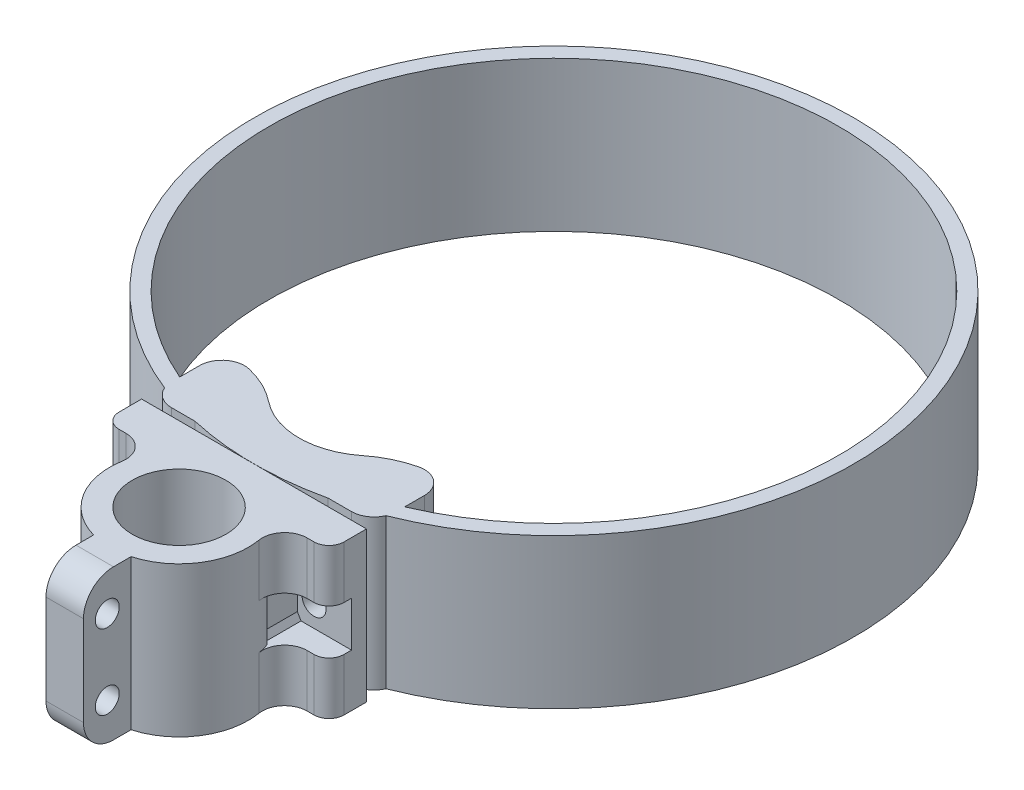
from build123d import *

# Parameters (mm, degrees)
SKETCH_1_R           = 9.25
SKETCH_1_R_2         = 6.25
EXTRUDE_1_DEPTH      = 20
EXTRUDE_2_DEPTH      = 20
CUT_EXTRUDE_1_REACH  = 33.553
SKETCH_4_R           = 1.6
CUT_EXTRUDE_START    = -3
SKETCH_7_R           = 1.6
CUT_EXTRUDE_5_DEPTH  = 3
SKETCH_9_W           = 5
SKETCH_9_H           = 7
EXTRUDE_3_DEPTH      = 20
CUT_EXTRUDE_7_REACH  = 32.64
SKETCH_10_R          = 1.6
FILLET_1_R           = 4
EXTRUDE_4_DEPTH      = 7
CUT_EXTRUDE_8_DEPTH  = 5
EXTRUDE_5_DEPTH      = 1
EXTRUDE_6_DEPTH      = 20
FILLET_7_R           = 13
CUT_EXTRUDE_START_2  = -10
SKETCH_19_R          = 1.6
CUT_EXTRUDE_9_DEPTH  = 9.712728
SKETCH_20_R          = 3
CUT_EXTRUDE_10_DEPTH = 6
FILLET_4_R           = 2
FILLET_5_R           = 2
FILLET_6_R           = 3
EXTRUDE_START        = -20
SKETCH_21_R          = 40
SKETCH_21_R_2        = 38
EXTRUDE_7_DEPTH      = 20


with BuildPart() as part:
    # 草图1 → 凸台-拉伸1 (new body)
    with BuildSketch(Plane(origin=(0, 0, 0), x_dir=(1, 0, 0), z_dir=(0, 1, 0))):
        with Locations(Location((0, 0, 0), (0, 0, 270))):
            Circle(SKETCH_1_R)
        with Locations(Location((0, 0, 0), (0, 0, 270))):
            Circle(SKETCH_1_R_2, mode=Mode.SUBTRACT)
    extrude(amount=EXTRUDE_1_DEPTH)

    # 草图3 → 凸台-拉伸2 (add)
    with BuildSketch(Plane.XZ):
        with BuildLine():
            Line((-15, -10), (15, -10))
            Line((15, -10), (15, -5))
            Line((15, -5), (3.75, -5))
            ThreePointArc((3.75, -5), (0, -6.25), (-3.75, -5))
            Line((-3.75, -5), (-15, -5))
            Line((-15, -5), (-15, -10))
        make_face()
    extrude(amount=-EXTRUDE_2_DEPTH)

    # 草图4 → 切除-拉伸1 (cut, up to next)
    with BuildSketch(Plane(origin=(0, 0, -10), x_dir=(-1, 0, 0), z_dir=(0, 0, -1)), mode=Mode.PRIVATE) as cut_extrude_1_sk1:
        with Locations((-10, 10)):
            Circle(SKETCH_4_R)
    cut_extrude_1_tool1 = extrude(cut_extrude_1_sk1.sketch, amount=-CUT_EXTRUDE_1_REACH, mode=Mode.PRIVATE) & part.part
    # 草图4 → 切除-拉伸1 (cut, up to next)
    with BuildSketch(Plane(origin=(0, 0, -10), x_dir=(-1, 0, 0), z_dir=(0, 0, -1)), mode=Mode.PRIVATE) as cut_extrude_1_sk2:
        with Locations(Location((10, 10, 0), (0, 0, 180))):
            Circle(SKETCH_4_R)
    cut_extrude_1_tool2 = extrude(cut_extrude_1_sk2.sketch, amount=-CUT_EXTRUDE_1_REACH, mode=Mode.PRIVATE) & part.part
    add(cut_extrude_1_tool1.solids().sort_by_distance((10, 10, -10))[0], mode=Mode.SUBTRACT)
    add(cut_extrude_1_tool2.solids().sort_by_distance((-10, 10, -10))[0], mode=Mode.SUBTRACT)

    # 草图7 → 切除-拉伸5 (cut)
    # profile 1 of 2: a face of its own
    with BuildSketch(Plane.XY.offset(-5).offset(CUT_EXTRUDE_START)):
        Polygon((-15, 7), (-8.267949192, 7), (-6.535898385, 10), (-8.267949192, 13), (-15, 13), align=None)
        with Locations((-10, 10)):
            Circle(SKETCH_7_R, mode=Mode.SUBTRACT)
    # profile 2 of 2: a face of its own
    with BuildSketch(Plane.XY.offset(-5).offset(CUT_EXTRUDE_START)):
        Polygon((15, 13), (8.267949192, 13), (7.782191208, 12.158642491), (7.782191208, 7.841357509), (8.267949192, 7), (15, 7), align=None)
        with Locations(Location((10, 10, 0), (0, 0, 180))):
            Circle(SKETCH_7_R, mode=Mode.SUBTRACT)
    extrude(amount=CUT_EXTRUDE_5_DEPTH, mode=Mode.SUBTRACT)

    # 草图9 → 凸台-拉伸3 (add)
    with BuildSketch(Plane(origin=(0, 0, 0), x_dir=(1, 0, 0), z_dir=(0, 1, 0))):
        with Locations((0, -11.75)):
            Rectangle(SKETCH_9_W, SKETCH_9_H)
    extrude(amount=EXTRUDE_3_DEPTH)

    # 草图10 → 切除-拉伸7 (cut, up to next)
    with BuildSketch(Plane.ZY.offset(2.5), mode=Mode.PRIVATE) as cut_extrude_7_sk1:
        with Locations((12.077878283, 15)):
            Circle(SKETCH_10_R)
    cut_extrude_7_tool1 = extrude(cut_extrude_7_sk1.sketch, amount=-CUT_EXTRUDE_7_REACH, mode=Mode.PRIVATE) & part.part
    # 草图10 → 切除-拉伸7 (cut, up to next)
    with BuildSketch(Plane.ZY.offset(2.5), mode=Mode.PRIVATE) as cut_extrude_7_sk2:
        with Locations((12.077878283, 5)):
            Circle(SKETCH_10_R)
    cut_extrude_7_tool2 = extrude(cut_extrude_7_sk2.sketch, amount=-CUT_EXTRUDE_7_REACH, mode=Mode.PRIVATE) & part.part
    add(cut_extrude_7_tool1.solids().sort_by_distance((-2.5, 15, 12.077878))[0], mode=Mode.SUBTRACT)
    add(cut_extrude_7_tool2.solids().sort_by_distance((-2.5, 5, 12.077878))[0], mode=Mode.SUBTRACT)

    # 圆角1
    fillet_1_edges = [part.edges().sort_by_distance(p)[0] for p in [
        (0, 0, 15.25),
        (0, 20, 15.25),
    ]]
    fillet(fillet_1_edges, radius=FILLET_1_R)

    # 草图11 → 凸台-拉伸4 (add)
    with BuildSketch(Plane.XZ):
        with BuildLine():
            Line((12.085631965, -5), (7.782191208, -5))
            ThreePointArc((7.782191208, -5), (8.632232168, -3.323712952), (9.125885362, -1.510204082))
            ThreePointArc((9.125885362, -1.510204082), (9.797686626, -3.940439672), (12.085631965, -5))
        make_face()
        with BuildLine():
            Line((-12.085631965, -5), (-7.782191208, -5))
            ThreePointArc((-7.782191208, -5), (-8.632232168, -3.323712952), (-9.125885362, -1.510204082))
            ThreePointArc((-9.125885362, -1.510204082), (-9.797686626, -3.940439672), (-12.085631965, -5))
        make_face()
    extrude_4 = extrude(amount=-EXTRUDE_4_DEPTH)

    # 镜向2: 凸台-拉伸4 across plane
    add(extrude_4.mirror(Plane.ZX.offset(10)))

    # 草图16 → 切除-拉伸8 (cut)
    with BuildSketch(Plane.XY.offset(-8)):
        Polygon((8.267949192, 7), (15, 7), (15, 13), (8.267949192, 13), (7.782191208, 12.158642491), (7.782191208, 7.841357509), align=None)
        Polygon((-15, 7), (-8.267949192, 7), (-6.535898385, 10), (-8.267949192, 13), (-15, 13), align=None)
    extrude(amount=CUT_EXTRUDE_8_DEPTH, mode=Mode.SUBTRACT)

    # 草图17 → 凸台-拉伸5 (add)
    with BuildSketch(Plane.XY.offset(-5)):
        Polygon((-8.267949192, 7), (-7.782191208, 7), (-7.782191208, 7.841357509), align=None)
        Polygon((-7.782191208, 13), (-8.267949192, 13), (-7.782191208, 12.158642491), align=None)
        Polygon((7.782191208, 12.158642491), (8.267949192, 13), (7.782191208, 13), align=None)
        Polygon((7.782191208, 7.841357509), (7.782191208, 7), (8.267949192, 7), align=None)
    extrude(amount=EXTRUDE_5_DEPTH)


with BuildPart() as body_2:
    # Split Bodies 1: the piece on the far side of the plane
    add(part.part)
    split(bisect_by=Plane(origin=(0, 0, 0), x_dir=(0, 0, 1), z_dir=(1, 0, 0)), keep=Keep.BOTTOM)

    # 圆角5
    fillet_5_edges = [body_2.edges().sort_by_distance(p)[0] for p in [
        (-15, 3.5, -5),
        (-15, 16.5, -5),
    ]]
    fillet(fillet_5_edges, radius=FILLET_5_R)


with BuildPart() as part_1:
    add(part.part)

    # Split Bodies 1
    split(bisect_by=Plane(origin=(0, 0, 0), x_dir=(0, 0, 1), z_dir=(1, 0, 0)), keep=Keep.TOP)

    # 圆角4
    fillet_4_edges = [part_1.edges().sort_by_distance(p)[0] for p in [
        (15, 16.5, -5),
        (15, 3.5, -5),
    ]]
    fillet(fillet_4_edges, radius=FILLET_4_R)

    add(body_2.part)  # 凸台-拉伸7 merges body 2


with BuildPart() as body_3:
    # 草图18 → 凸台-拉伸6 (new body)
    with BuildSketch(Plane.XZ):
        with BuildLine():
            Line((0, -16), (0, -11))
            Line((0, -11), (-15, -11))
            Line((-15, -11), (-15, -21))
            Line((-15, -21), (-8.660254038, -21))
            ThreePointArc((-8.660254038, -21), (-5, -17.339745962), (0, -16))
        make_face()
        with BuildLine():
            Line((15, -11), (0, -11))
            Line((0, -11), (0, -16))
            ThreePointArc((0, -16), (5, -17.339745962), (8.660254038, -21))
            Line((8.660254038, -21), (15, -21))
            Line((15, -21), (15, -11))
        make_face()
    extrude(amount=-EXTRUDE_6_DEPTH)

    # 圆角7
    fillet_7_edges = [body_3.edges().sort_by_distance(p)[0] for p in [
        (-8.660254038, 10, -21),
        (8.660254038, 10, -21),
    ]]
    fillet(fillet_7_edges, radius=FILLET_7_R)

    # 草图19 → 切除-拉伸9 (cut)
    with BuildSketch(Plane(origin=(0, 0, -21), x_dir=(-1, 0, 0), z_dir=(0, 0, -1)).offset(CUT_EXTRUDE_START_2)):
        with Locations((10, 10)):
            Circle(SKETCH_19_R)
        with Locations((-10, 10)):
            Circle(SKETCH_19_R)
    extrude(amount=CUT_EXTRUDE_9_DEPTH, mode=Mode.SUBTRACT)

    # 草图20 → 切除-拉伸10 (cut)
    with BuildSketch(Plane(origin=(0, 0, -21), x_dir=(-1, 0, 0), z_dir=(0, 0, -1))):
        with Locations((10, 10)):
            Circle(SKETCH_20_R)
        with Locations((-10, 10)):
            Circle(SKETCH_20_R)
    extrude(amount=-CUT_EXTRUDE_10_DEPTH, mode=Mode.SUBTRACT)

    # 圆角6
    # the kernel refuses this fillet: 3 mm, written as the material it takes off along each edge
    with BuildSketch(Plane(origin=(-15, -7.5, -11), x_dir=(0, 0, -1), z_dir=(0, 1, 0)), Plane(origin=(15, -7.5, -11), x_dir=(-1, 0, 0), z_dir=(0, 1, 0))) as fillet_6_piece_1:
        with BuildLine():
            CenterArc((FILLET_6_R, -FILLET_6_R), FILLET_6_R, 90, 90)
            Line((0, -FILLET_6_R), (0, 0))
            Line((0, 0), (FILLET_6_R, 0))
        make_face()
    extrude(amount=35, mode=Mode.SUBTRACT)
    with BuildSketch(Plane(origin=(-15, -9.280663445, -21), x_dir=(0.9954423896624867, 0, 0.09536481983959225), z_dir=(0, 1, 0))) as fillet_6_piece_2:
        with BuildLine():
            CenterArc((3.298391634, -2.971314276), FILLET_6_R, 82.070303254, 103.40201453)
            Line((0.312064465, -3.257408735), (0.013431749, -3.286018181))
            Line((0.013431749, -3.286018181), (-0.298632717, -0.028609446))
            Line((-0.298632717, -0.028609446), (-0.028609446, 0.298632717))
            ThreePointArc((-0.028609446, 0.298632717), (0.650460385, 0.363688588), (3.753652752, 0.297131428))
            Line((3.753652752, 0.297131428), (3.712265378, 0))
        make_face()
    extrude(amount=38.56132689, mode=Mode.SUBTRACT)
    with BuildSketch(Plane(origin=(15, -9.280663445, -21), x_dir=(0, 0, 1), z_dir=(0, 1, 0))) as fillet_6_piece_3:
        with BuildLine():
            CenterArc((3.272322707, -3), FILLET_6_R, 90, 103.40201453)
            Line((0.354019519, -3.695346319), (0.0621892, -3.764880951))
            ThreePointArc((0.0621892, -3.764880951), (-0.3, -0.682178937), (-0.3, 0))
            Line((-0.3, 0), (0, 0.3))
            Line((0, 0.3), (3.272322707, 0.3))
            Line((3.272322707, 0.3), (3.272322707, 0))
        make_face()
    extrude(amount=38.56132689, mode=Mode.SUBTRACT)


with BuildPart() as part_2:
    add(part_1.part)

    add(body_3.part)  # 凸台-拉伸7 merges body 3
    # 草图21 → 凸台-拉伸7 (add)
    with BuildSketch(Plane(origin=(0, 20, 0), x_dir=(1, 0, 0), z_dir=(0, 1, 0)).offset(EXTRUDE_START)):
        with Locations((0, 50)):
            Circle(SKETCH_21_R)
        with Locations((0, 50)):
            Circle(SKETCH_21_R_2, mode=Mode.SUBTRACT)
    extrude(amount=EXTRUDE_7_DEPTH)


solid = part_2.part
